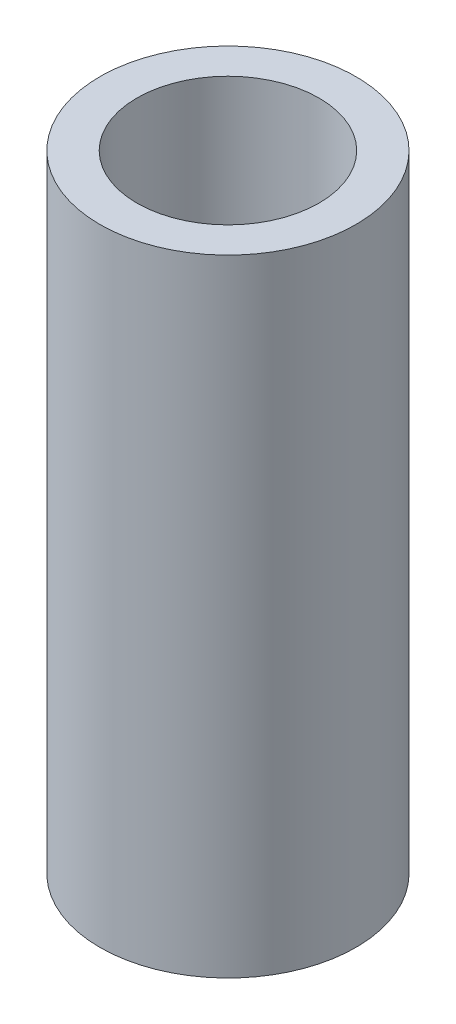
from build123d import *

# Parameters (mm, degrees)
SKETCH1_R           = 2.25
SKETCH1_R_2         = 1.6
BOSS_EXTRUDE1_DEPTH = 5.5


with BuildPart() as part:
    # Sketch1 → Boss-Extrude1 (new, symmetric)
    with BuildSketch(Plane(origin=(0, 0, 0), x_dir=(1, 0, 0), z_dir=(0, 1, 0))):
        Circle(SKETCH1_R)
        Circle(SKETCH1_R_2, mode=Mode.SUBTRACT)
    extrude(amount=BOSS_EXTRUDE1_DEPTH, both=True)


solid = part.part
